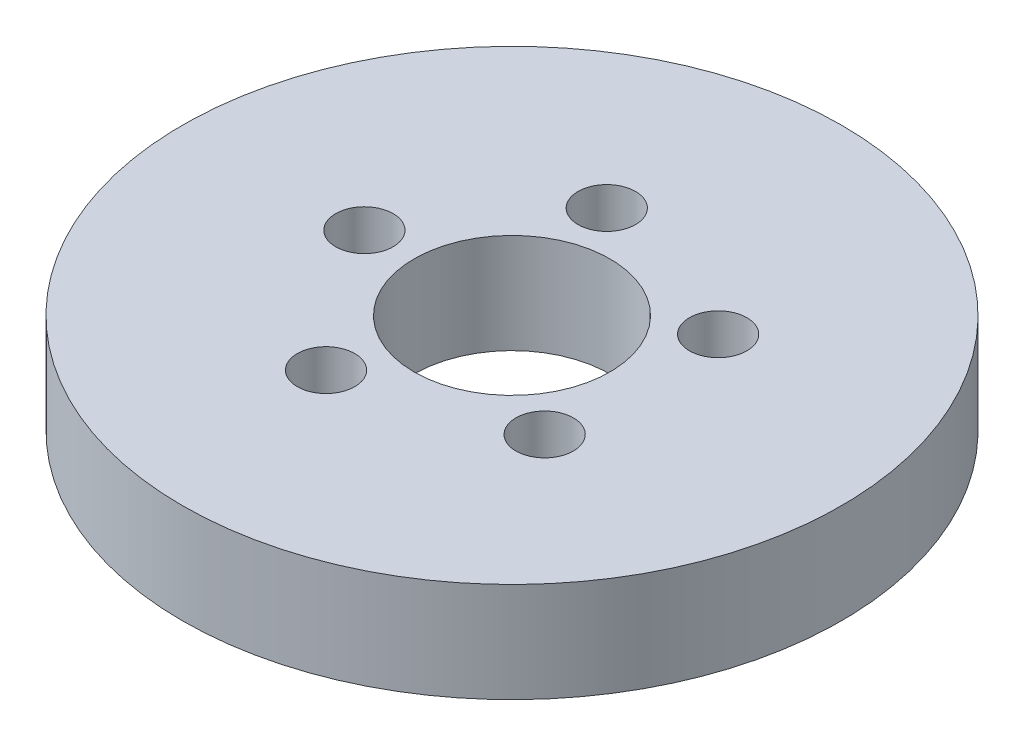
from build123d import *

# Parameters (mm, degrees)
SKETCH1_R           = 92.5
BOSS_EXTRUDE1_DEPTH = 28
SKETCH2_R           = 27.5
CUT_EXTRUDE1_DEPTH  = 134.777800849
SKETCH3_R           = 8.067239177
CUT_EXTRUDE2_DEPTH  = 21.625953126
CIRPATTERN1_COUNT   = 5


with BuildPart() as part:
    # Sketch1 → Boss-Extrude1 (new body)
    with BuildSketch(Plane(origin=(0, 0, 0), x_dir=(1, 0, 0), z_dir=(0, 1, 0))):
        Circle(SKETCH1_R)
    extrude(amount=BOSS_EXTRUDE1_DEPTH)

    # Sketch2 → Cut-Extrude1 (cut, through all)
    with BuildSketch(Plane(origin=(0, 0, 0), x_dir=(1, 0, 0), z_dir=(0, 1, 0))):
        Circle(SKETCH2_R)
    extrude(amount=CUT_EXTRUDE1_DEPTH, mode=Mode.SUBTRACT)

    # Sketch3 → Cut-Extrude2 (cut)
    with BuildSketch(Plane(origin=(0, 28, 0), x_dir=(1, 0, 0), z_dir=(0, 1, 0))):
        with Locations((-41.426970059, 0)):
            Circle(SKETCH3_R)
    cut_extrude2 = extrude(amount=-CUT_EXTRUDE2_DEPTH, mode=Mode.SUBTRACT)

    # CirPattern1: Cut-Extrude2 ×5 about axis
    cirpattern1_axis = Axis((0, 0, 0), (0, 1, 0))
    for i in range(1, CIRPATTERN1_COUNT):
        add(cut_extrude2.rotate(cirpattern1_axis, i * 360 / CIRPATTERN1_COUNT), mode=Mode.SUBTRACT)


solid = part.part
